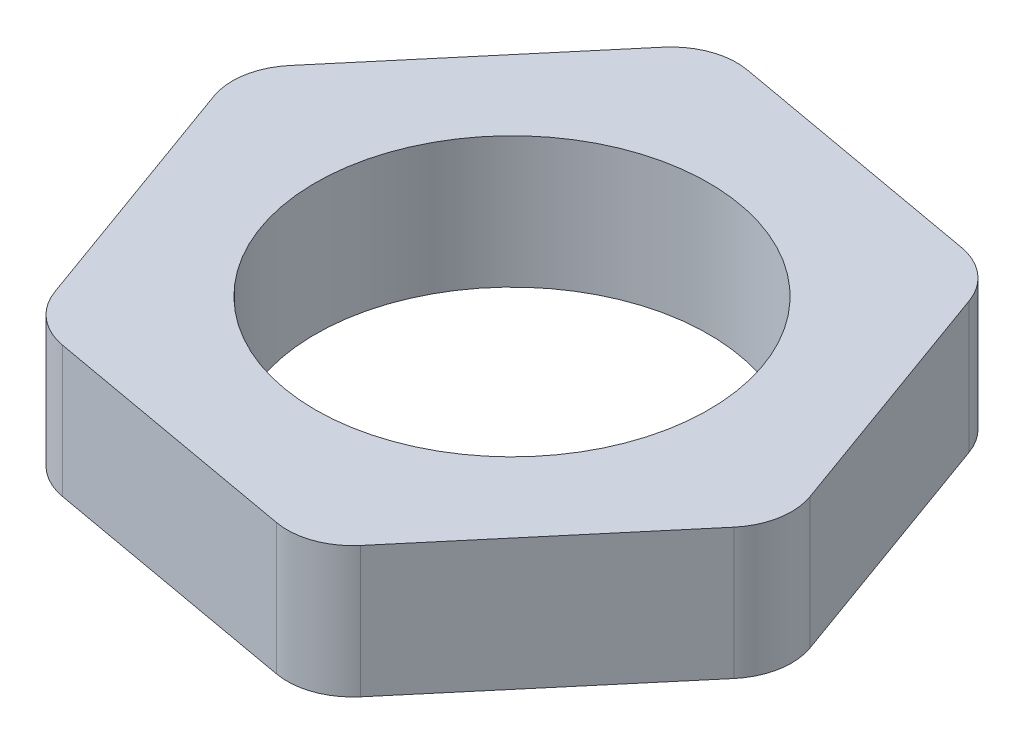
from build123d import *

# Parameters (mm, degrees)
SKETCH1_R           = 1.5
BOSS_EXTRUDE1_DEPTH = 1
FILLET1_R           = 0.5


with BuildPart() as part:
    # Sketch1 → Boss-Extrude1 (new body)
    with BuildSketch(Plane(origin=(0, 0, 0), x_dir=(1, 0, 0), z_dir=(0, 1, 0))):
        Polygon((-0.882465479, 2.443615084), (-2.557465479, 0.457570019), (-1.675, -1.986045065), (0.882465479, -2.443615084), (2.557465479, -0.457570019), (1.675, 1.986045065), align=None)
        Circle(SKETCH1_R, mode=Mode.SUBTRACT)
    extrude(amount=BOSS_EXTRUDE1_DEPTH)

    # Fillet1
    fillet1_edges = [part.edges().sort_by_distance(p)[0] for p in [
        (-0.882465479, 0.5, -2.443615084),
        (-2.557465479, 0.5, -0.457570019),
        (-1.675, 0.5, 1.986045065),
        (0.882465479, 0.5, 2.443615084),
        (2.557465479, 0.5, 0.457570019),
        (1.675, 0.5, -1.986045065),
    ]]
    fillet(fillet1_edges, radius=FILLET1_R)


solid = part.part
